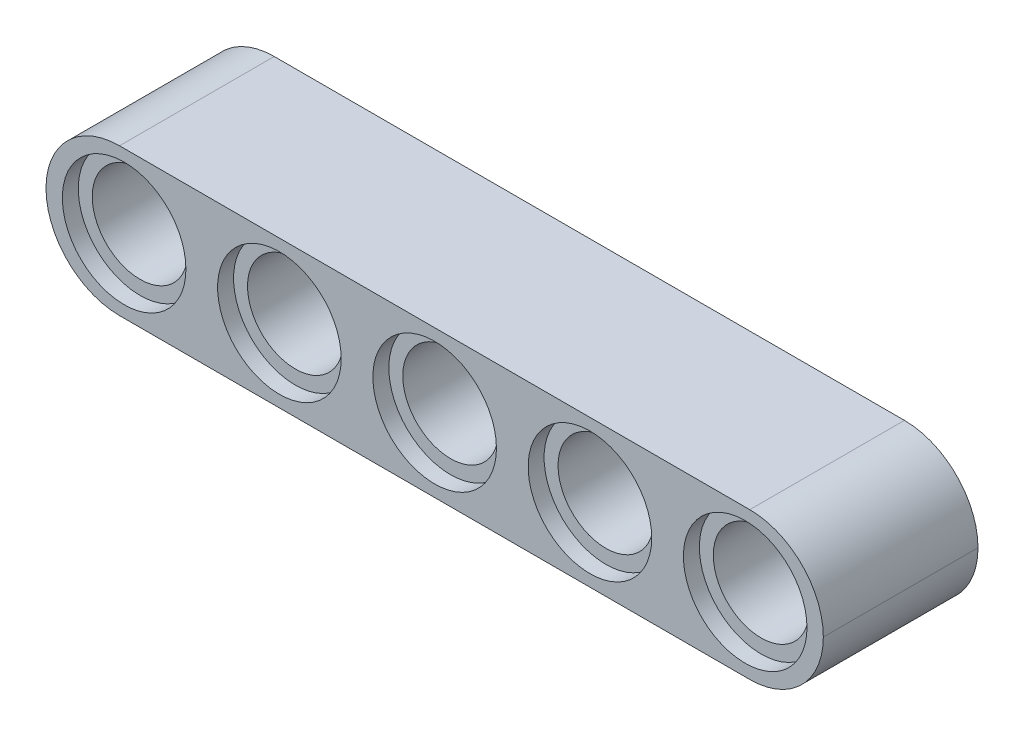
from build123d import *

# Parameters (mm, degrees)
SKETCH1_W                = 39
SKETCH1_H                = 7.38
BOSS_EXTRUDE1_DEPTH      = 7.76
SKETCH2_R                = 2.4
CUT_EXTRUDE1_DEPTH       = 7.76
CUT_EXTRUDE2_OUTLINE_R   = 3.1
CUT_EXTRUDE2_OUTLINE_R_2 = 2.4
CUT_EXTRUDE2_DEPTH       = 0.8
CUT_EXTRUDE3_START       = 6.96
CUT_EXTRUDE3_OUTLINE_R   = 3.1
CUT_EXTRUDE3_OUTLINE_R_2 = 2.4
CUT_EXTRUDE3_DEPTH       = 0.8
LPATTERN3_COUNT          = 3
LPATTERN3_PITCH          = 7.79
LPATTERN6_COUNT          = 3
LPATTERN6_PITCH          = 7.79
FILLET1_R                = 3.69
FILLET2_R                = 3.69
FILLET3_R                = 3.69
FILLET4_R                = 3.69


# Read off the part's stored shape, not the designer's step: Cut-Extrude2, Cut-Extrude3
with BuildPart() as part:
    # Sketch1 → Boss-Extrude1 (new body)
    with BuildSketch(Plane.XY):
        with Locations((19.5, 3.69)):
            Rectangle(SKETCH1_W, SKETCH1_H)
    extrude(amount=BOSS_EXTRUDE1_DEPTH)

    # Sketch2 → Cut-Extrude1 (cut)
    with BuildSketch(Plane.XY.offset(7.76)):
        with Locations((19.5, 3.69)):
            Circle(SKETCH2_R)
    cut_extrude1 = extrude(amount=-CUT_EXTRUDE1_DEPTH, mode=Mode.SUBTRACT)

    # Cut-Extrude2 outline → Cut-Extrude2 (cut)
    with BuildSketch(Plane.XY):
        with Locations((19.5, 3.69)):
            Circle(CUT_EXTRUDE2_OUTLINE_R)
        with Locations((19.5, 3.69)):
            Circle(CUT_EXTRUDE2_OUTLINE_R_2, mode=Mode.SUBTRACT)
    cut_extrude2 = extrude(amount=CUT_EXTRUDE2_DEPTH, mode=Mode.SUBTRACT)

    # Cut-Extrude3 outline → Cut-Extrude3 (cut)
    with BuildSketch(Plane.XY.offset(CUT_EXTRUDE3_START)):
        with Locations((19.5, 3.69)):
            Circle(CUT_EXTRUDE3_OUTLINE_R)
        with Locations((19.5, 3.69)):
            Circle(CUT_EXTRUDE3_OUTLINE_R_2, mode=Mode.SUBTRACT)
    cut_extrude3 = extrude(amount=CUT_EXTRUDE3_DEPTH, mode=Mode.SUBTRACT)

    # LPattern3: Cut-Extrude1, Cut-Extrude2, Cut-Extrude3 ×3
    with Locations(*[(-i * LPATTERN3_PITCH, 0, 0) for i in range(1, LPATTERN3_COUNT)]):
        add(cut_extrude1, mode=Mode.SUBTRACT)
        add(cut_extrude2, mode=Mode.SUBTRACT)
        add(cut_extrude3, mode=Mode.SUBTRACT)

    # LPattern6: Cut-Extrude1, Cut-Extrude2, Cut-Extrude3 ×3
    with Locations(*[(i * LPATTERN6_PITCH, 0, 0) for i in range(1, LPATTERN6_COUNT)]):
        add(cut_extrude1, mode=Mode.SUBTRACT)
        add(cut_extrude2, mode=Mode.SUBTRACT)
        add(cut_extrude3, mode=Mode.SUBTRACT)

    # Fillet1
    fillet1_edges = [part.edges().sort_by_distance(p)[0] for p in [
        (0, 7.38, 3.88),
    ]]
    fillet(fillet1_edges, radius=FILLET1_R)

    # Fillet2
    fillet2_edges = [part.edges().sort_by_distance(p)[0] for p in [
        (0, 0, 3.88),
    ]]
    fillet(fillet2_edges, radius=FILLET2_R - 0.0001)  # a hair under: the kernel refuses the full size

    # Fillet3
    fillet3_edges = [part.edges().sort_by_distance(p)[0] for p in [
        (39, 7.38, 3.88),
    ]]
    fillet(fillet3_edges, radius=FILLET3_R)

    # Fillet4
    fillet4_edges = [part.edges().sort_by_distance(p)[0] for p in [
        (39, 0, 3.88),
    ]]
    fillet(fillet4_edges, radius=FILLET4_R - 0.0001)  # a hair under: the kernel refuses the full size


solid = part.part
